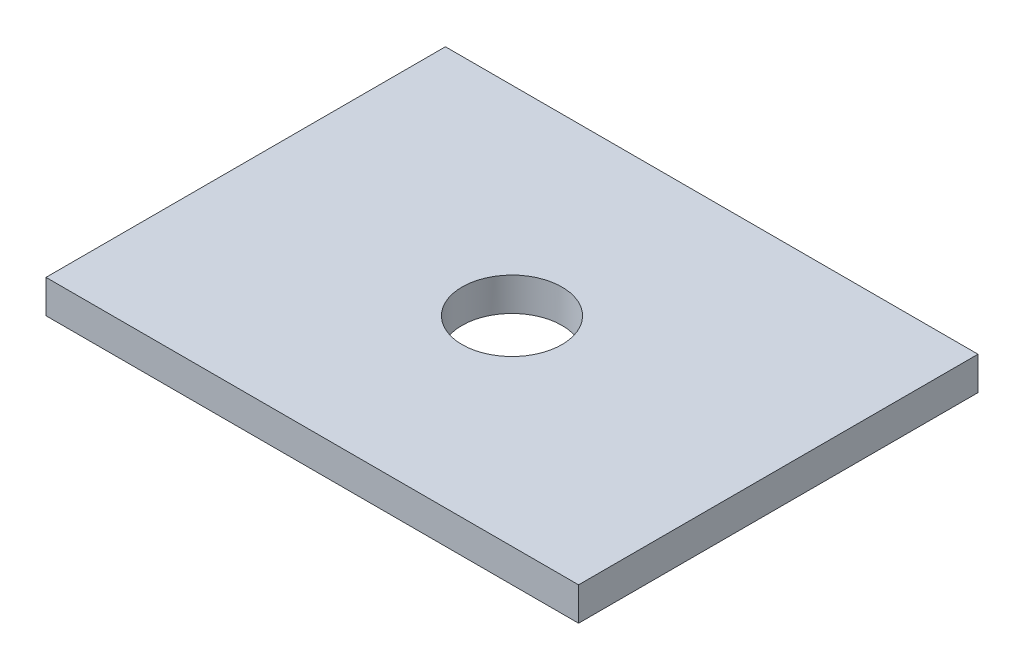
from build123d import *

# Parameters (mm, degrees)
SKETCH1_W          = 160
SKETCH1_H          = 120
BASE_DEPTH         = 10
SKETCH2_R          = 15
ACTUATOR_CUT_DEPTH = 40


with BuildPart() as part:
    # Sketch1 → base (new body)
    with BuildSketch(Plane(origin=(0, 0, 0), x_dir=(1, 0, 0), z_dir=(0, 1, 0))):
        Rectangle(SKETCH1_W, SKETCH1_H)
    extrude(amount=BASE_DEPTH)

    # Sketch2 → actuator cut (cut)
    with BuildSketch(Plane(origin=(0, 10, 0), x_dir=(1, 0, 0), z_dir=(0, 1, 0))):
        Circle(SKETCH2_R)
    extrude(amount=-ACTUATOR_CUT_DEPTH, mode=Mode.SUBTRACT)


solid = part.part
